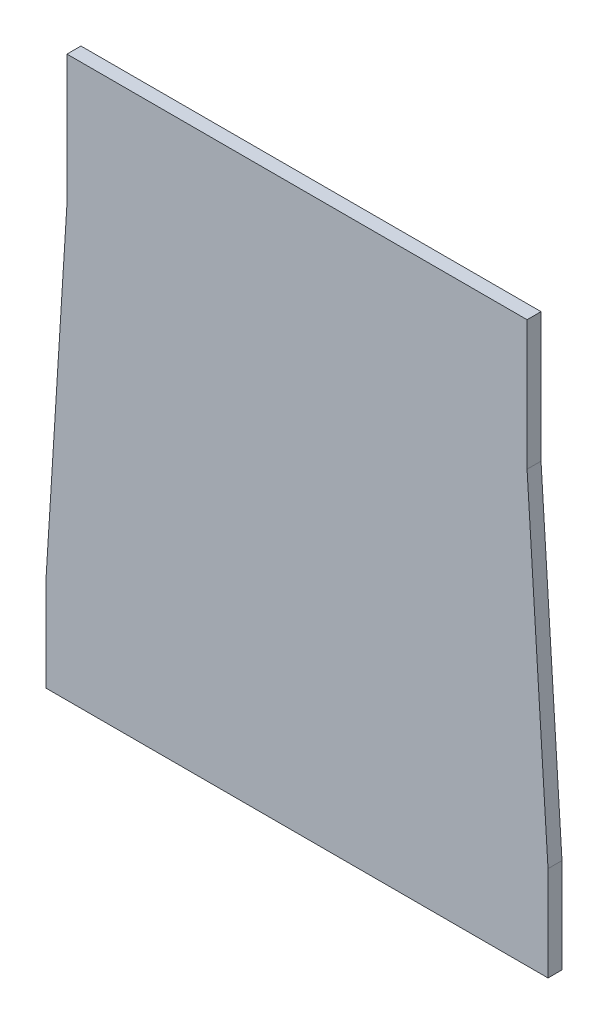
from build123d import *

# Parameters (mm, degrees)
SKETCH1_W           = 418.07892
SKETCH1_H           = 415.925
BOSS_EXTRUDE1_DEPTH = 12.7
SKETCH2_W           = 418.07892
SKETCH2_H           = 79.68996
BOSS_EXTRUDE2_DEPTH = 12.7
SKETCH3_W           = 418.07892
SKETCH3_H           = 28.376126504
BOSS_EXTRUDE3_DEPTH = 12.7
BOSS_EXTRUDE4_DEPTH = 12.7
CHAMFER1_SIZE       = 304.8
CHAMFER1_SIZE_2     = 19.05
SKETCH5_W           = 12.7
SKETCH5_H           = 15.453987587
CUT_EXTRUDE1_DEPTH  = 5568.603780331


with BuildPart() as part:
    # Sketch1 → Boss-Extrude1 (new body)
    with BuildSketch(Plane.XY):
        with Locations((0, -5261.217030575)):
            Rectangle(SKETCH1_W, SKETCH1_H)
    extrude(amount=BOSS_EXTRUDE1_DEPTH)

    # Sketch2 → Boss-Extrude2 (add, through all)
    with BuildSketch(Plane(origin=(0, 0, 0), x_dir=(-1, 0, 0), z_dir=(0, 0, -1))):
        with Locations((0, -5509.024510575)):
            Rectangle(SKETCH2_W, SKETCH2_H)
    extrude(amount=-BOSS_EXTRUDE2_DEPTH)

    # Sketch3 → Boss-Extrude3 (add, through all)
    with BuildSketch(Plane(origin=(0, 0, 0), x_dir=(-1, 0, 0), z_dir=(0, 0, -1))):
        with Locations((0, -5039.066467323)):
            Rectangle(SKETCH3_W, SKETCH3_H)
    extrude(amount=-BOSS_EXTRUDE3_DEPTH)

    # Sketch4 → Boss-Extrude4 (add, through all)
    with BuildSketch(Plane(origin=(0, 0, 0), x_dir=(-1, 0, 0), z_dir=(0, 0, -1))):
        Polygon((209.038766336, -5447.352766987), (228.088766336, -5447.352766987), (228.088766336, -5548.869490575), (209.03946, -5548.869490575), align=None)
        Polygon((-209.03946, -5548.869490575), (-209.038766336, -5447.352766987), (-228.088766336, -5447.352766987), (-228.088766336, -5548.869490575), align=None)
    extrude(amount=-BOSS_EXTRUDE4_DEPTH)

    # Chamfer1
    # the kernel refuses this chamfer: 304.8, 19.05 mm, written as the material it adds along each edge
    with BuildSketch(Plane(origin=(-209.03946, -5447.352766987, 0), x_dir=(0.002399337658707147, 0.9999971215852571, 0), z_dir=(0, 0, 1))) as chamfer1_piece_1_section:
        Polygon((CHAMFER1_SIZE * 0.999997121585, CHAMFER1_SIZE * 0.00239933765871), (-CHAMFER1_SIZE_2 * 0.00239933765871, CHAMFER1_SIZE_2 * 0.999997121585), (0, 0), align=None)
    chamfer1_piece_1 = extrude(amount=12.7, mode=Mode.PRIVATE)
    chamfer1_piece_1 = split(chamfer1_piece_1, bisect_by=Plane(origin=(-228.088766336, -5325.682018196, 6.35), z_dir=(1, 0, 0)), keep=Keep.TOP, mode=Mode.PRIVATE)
    add(chamfer1_piece_1)
    with BuildSketch(Plane(origin=(209.03946, -5447.352766987, 0), x_dir=(0.8520963193143735, -0.5233850041899339, 0), z_dir=(0, 0, 1))) as chamfer1_piece_2_section:
        Polygon((CHAMFER1_SIZE_2 * 0.852096319314, CHAMFER1_SIZE_2 * 0.52338500419), (-CHAMFER1_SIZE * 0.52338500419, CHAMFER1_SIZE * 0.852096319314), (0, 0), align=None)
    chamfer1_piece_2 = extrude(amount=12.7, mode=Mode.PRIVATE)
    chamfer1_piece_2 = split(chamfer1_piece_2, bisect_by=Plane(origin=(228.088766336, -5325.682018196, 6.35), z_dir=(-1, 0, 0)), keep=Keep.TOP, mode=Mode.PRIVATE)
    add(chamfer1_piece_2)

    # Sketch5 → Cut-Extrude1 (cut, through all)
    with BuildSketch(Plane(origin=(228.088766336, 0, 0), x_dir=(0, 0, -1), z_dir=(1, 0, 0))):
        with Locations((-6.35, -5541.142496782)):
            Rectangle(SKETCH5_W, SKETCH5_H)
    extrude(amount=-CUT_EXTRUDE1_DEPTH, mode=Mode.SUBTRACT)


solid = part.part
